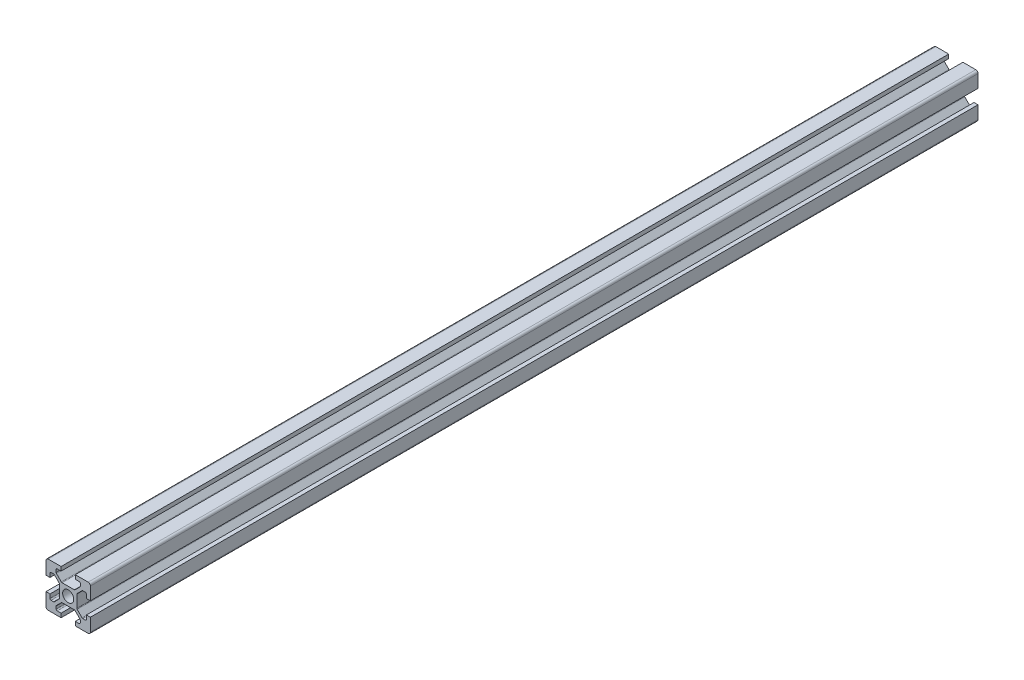
from build123d import *

# Parameters (mm, degrees)
SKETCH1_R           = 2.5
BOSS_EXTRUDE1_DEPTH = 400
FILLET1_R           = 1
FILLET2_R           = 0.5
FILLET3_R           = 0.5
FILLET4_R           = 0.5
FILLET5_R           = 0.5


with BuildPart() as part:
    # Sketch1 → Boss-Extrude1 (new body)
    with BuildSketch(Plane.XY):
        Polygon((0, 6.8), (0, 0), (6.8, 0), (6.8, 1.8), (4.55, 1.8), (4.55, 3.6), (7.05, 6.1), (12.95, 6.1), (15.45, 3.6), (15.45, 1.8), (13.2, 1.8), (13.2, 0), (20, 0), (20, 6.8), (18.2, 6.8), (18.2, 4.55), (16.4, 4.55), (13.9, 7.05), (13.9, 12.95), (16.4, 15.45), (18.2, 15.45), (18.2, 13.2), (20, 13.2), (20, 20), (13.2, 20), (13.2, 18.2), (15.45, 18.2), (15.45, 16.4), (12.95, 13.9), (7.05, 13.9), (4.55, 16.4), (4.55, 18.2), (6.8, 18.2), (6.8, 20), (0, 20), (0, 13.2), (1.8, 13.2), (1.8, 15.45), (3.6, 15.45), (6.1, 12.95), (6.1, 7.05), (3.6, 4.55), (1.8, 4.55), (1.8, 6.8), align=None)
        with Locations((10, 10)):
            Circle(SKETCH1_R, mode=Mode.SUBTRACT)
    extrude(amount=BOSS_EXTRUDE1_DEPTH)

    # Fillet1
    fillet1_edges = [part.edges().sort_by_distance(p)[0] for p in [
        (20, 20, 200),
        (20, 0, 200),
        (0, 0, 200),
        (0, 20, 200),
    ]]
    fillet(fillet1_edges, radius=FILLET1_R)

    # Fillet2
    fillet2_edges = [part.edges().sort_by_distance(p)[0] for p in [
        (4.55, 18.2, 200),
        (4.55, 16.4, 200),
        (7.05, 13.9, 200),
        (15.45, 18.2, 200),
        (15.45, 16.4, 200),
        (12.95, 13.9, 200),
    ]]
    fillet(fillet2_edges, radius=FILLET2_R)

    # Fillet3
    fillet3_edges = [part.edges().sort_by_distance(p)[0] for p in [
        (18.2, 15.45, 200),
        (16.4, 15.45, 200),
        (13.9, 12.95, 200),
        (18.2, 4.55, 200),
        (13.9, 7.05, 200),
        (16.4, 4.55, 200),
    ]]
    fillet(fillet3_edges, radius=FILLET3_R)

    # Fillet4
    fillet4_edges = [part.edges().sort_by_distance(p)[0] for p in [
        (1.8, 15.45, 200),
        (3.6, 15.45, 200),
        (6.1, 12.95, 200),
        (3.6, 4.55, 200),
        (1.8, 4.55, 200),
        (6.1, 7.05, 200),
    ]]
    fillet(fillet4_edges, radius=FILLET4_R)

    # Fillet5
    fillet5_edges = [part.edges().sort_by_distance(p)[0] for p in [
        (7.05, 6.1, 200),
        (4.55, 3.6, 200),
        (4.55, 1.8, 200),
        (15.45, 1.8, 200),
        (15.45, 3.6, 200),
        (12.95, 6.1, 200),
    ]]
    fillet(fillet5_edges, radius=FILLET5_R)


solid = part.part
